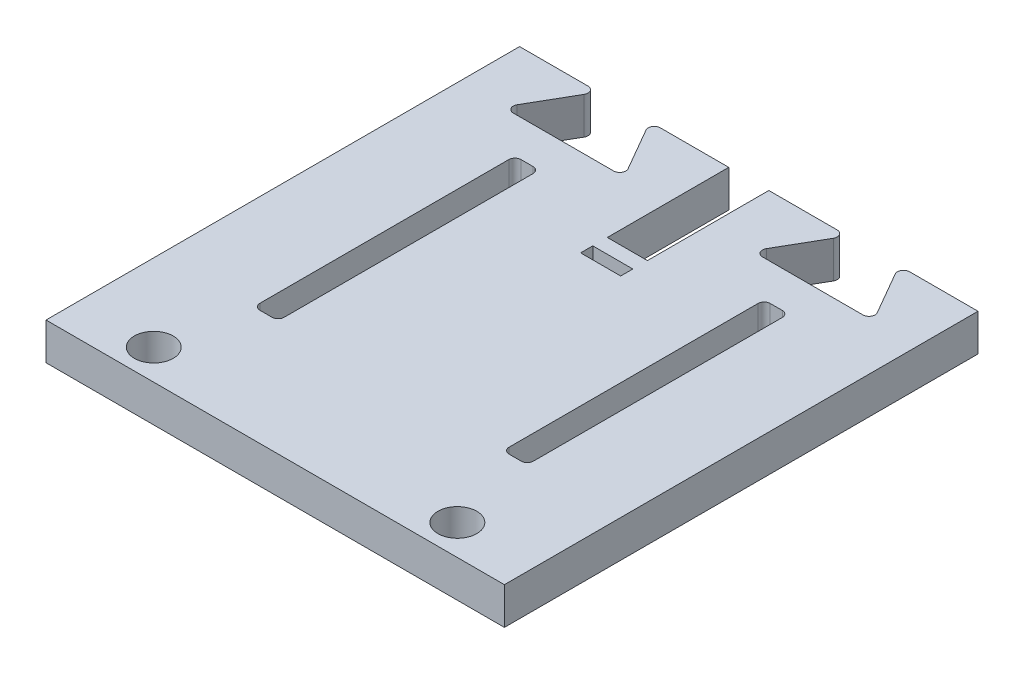
from build123d import *

# Parameters (mm, degrees)
BOSS_EXTRUDE1_DEPTH                = 3.05
FILLET3_R                          = 0.5
SKETCH2_W                          = 3.3
SKETCH2_H                          = 47
SKETCH2_H_2                        = 1
CUT_EXTRUDE1_DEPTH                 = 44.654245212
SKETCH6_W                          = 2
SKETCH6_H                          = 21.5
CUT_EXTRUDE2_DEPTH                 = 44.654245212
FILLET4_R                          = 0.5
M3_CLEARANCE_HEAD_MOUNTING_HOLES_D = 3.2
SKETCH7_W                          = 0.5
SKETCH7_H                          = 39
CUT_EXTRUDE3_DEPTH                 = 44.654245212


with BuildPart() as part:
    # Sketch1 → Boss-Extrude1 (new body)
    with BuildSketch(Plane(origin=(0, 0, 0), x_dir=(1, 0, 0), z_dir=(0, 1, 0))):
        Polygon((-19.375, 0), (-19.375, 39), (-12.375, 39), (-15.261751346, 34), (-5.261751346, 34), (-8.148502692, 39), (8.148502692, 39), (5.261751346, 34), (15.261751346, 34), (12.375, 39), (19.375, 39), (19.375, 0), align=None)
    extrude(amount=BOSS_EXTRUDE1_DEPTH)

    # Fillet3
    fillet3_edges = [part.edges().sort_by_distance(p)[0] for p in [
        (15.261751346, 1.525, -34),
        (12.375, 1.525, -39),
        (5.261751346, 1.525, -34),
        (8.148502692, 1.525, -39),
        (-8.148502692, 1.525, -39),
        (-5.261751346, 1.525, -34),
        (-15.261751346, 1.525, -34),
        (-12.375, 1.525, -39),
    ]]
    fillet(fillet3_edges, radius=FILLET3_R)

    # Sketch2 → Cut-Extrude1 (cut, through all)
    with BuildSketch(Plane(origin=(0, 3.05, 0), x_dir=(1, 0, 0), z_dir=(0, 1, 0))):
        with Locations((0, 52.5)):
            Rectangle(SKETCH2_W, SKETCH2_H)
        with Locations((0, 27.3)):
            Rectangle(SKETCH2_W, SKETCH2_H_2)
    extrude(amount=-CUT_EXTRUDE1_DEPTH, mode=Mode.SUBTRACT)

    # Sketch6 → Cut-Extrude2 (cut, through all)
    with BuildSketch(Plane(origin=(0, 3.05, 0), x_dir=(1, 0, 0), z_dir=(0, 1, 0))):
        with Locations((-10.261751346, 20.25)):
            Rectangle(SKETCH6_W, SKETCH6_H)
        with Locations((10.261751346, 20.25)):
            Rectangle(SKETCH6_W, SKETCH6_H)
    extrude(amount=-CUT_EXTRUDE2_DEPTH, mode=Mode.SUBTRACT)

    # Fillet4
    fillet4_edges = [part.edges().sort_by_distance(p)[0] for p in [
        (9.261751346, 1.525, -9.5),
        (11.261751346, 1.525, -9.5),
        (11.261751346, 1.525, -31),
        (9.261751346, 1.525, -31),
        (-11.261751346, 1.525, -9.5),
        (-9.261751346, 1.525, -9.5),
        (-9.261751346, 1.525, -31),
        (-11.261751346, 1.525, -31),
    ]]
    fillet(fillet4_edges, radius=FILLET4_R)

    # M3 Clearance Head Mounting Holes (through all)
    with Locations(Plane(origin=(0, 3.05, 0), x_dir=(1, 0, 0), z_dir=(0, 1, 0))):
        with Locations((-12.5, 2.5), (12.5, 2.5)):
            Hole(M3_CLEARANCE_HEAD_MOUNTING_HOLES_D / 2)

    # Sketch7 → Cut-Extrude3 (cut, through all)
    with BuildSketch(Plane(origin=(0, 3.05, 0), x_dir=(1, 0, 0), z_dir=(0, 1, 0))):
        with Locations((-19.125, 19.5)):
            Rectangle(SKETCH7_W, SKETCH7_H)
        with Locations((19.125, 19.5)):
            Rectangle(SKETCH7_W, SKETCH7_H)
    extrude(amount=-CUT_EXTRUDE3_DEPTH, mode=Mode.SUBTRACT)


solid = part.part
